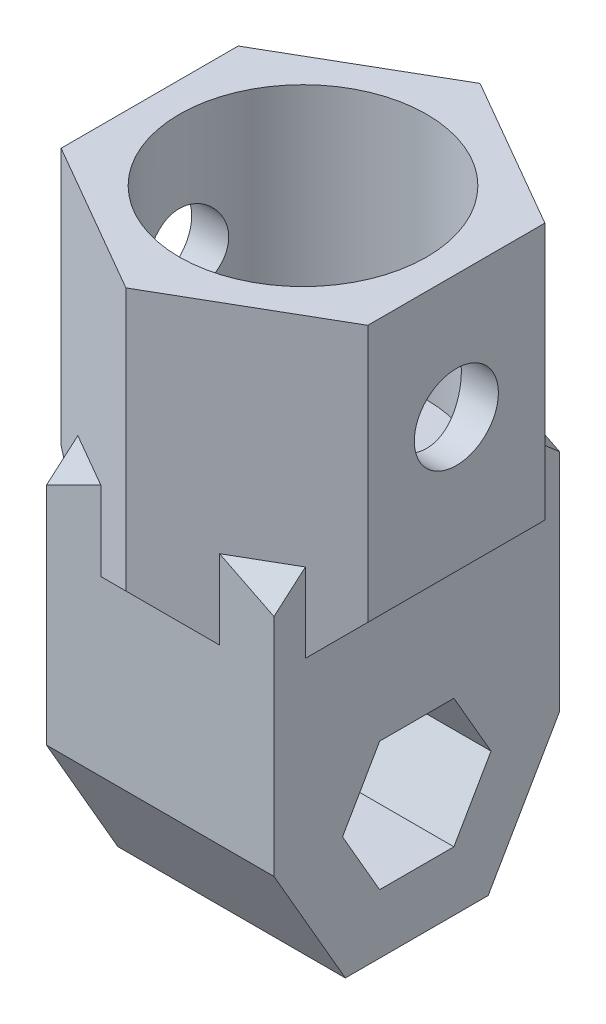
from build123d import *

# Parameters (mm, degrees)
SALIENTE_EXTRUIR1_DEPTH      = 4.6
SALIENTE_EXTRUIR1_DEPTH_BACK = 4.6
SALIENTE_EXTRUIR2_START      = 4
CROQUIS2_R                   = 5
SALIENTE_EXTRUIR2_DEPTH      = 10
CROQUIS4_W                   = 9.2
CROQUIS4_H                   = 2.771281292
SALIENTE_EXTRUIR3_DEPTH      = 9
SALIENTE_EXTRUIR4_START      = 2.6
CROQUIS4_3_W                 = 9.2
CROQUIS4_3_H                 = 6.0044428
SALIENTE_EXTRUIR4_DEPTH      = 6.4
SALIENTE_EXTRUIR5_START      = 3.6
CROQUIS2_2_R                 = 5
SALIENTE_EXTRUIR5_DEPTH      = 0.4
CHAFL_N1_SIZE                = 1.2
CHAFL_N2_SIZE                = 1.6
CROQUIS5_R                   = 1.7
CORTAR_EXTRUIR1_DEPTH        = 24.791034726


with BuildPart() as part:
    # Croquis1 → Saliente-Extruir1 (new, two sides: drawn at the far end of the back side and taken through both)
    with BuildSketch(Plane(origin=(0, 0, 0), x_dir=(0, 0, -1), z_dir=(1, 0, 0)).offset(-SALIENTE_EXTRUIR1_DEPTH_BACK)):
        Polygon((2.886751346, 5), (-2.886751346, 5), (-5.773502692, 0), (-2.886751346, -5), (2.886751346, -5), (5.773502692, 0), align=None)
        Polygon((3.0022214, 0), (1.5011107, 2.6), (-1.5011107, 2.6), (-3.0022214, 0), (-1.5011107, -2.6), (1.5011107, -2.6), align=None, mode=Mode.SUBTRACT)
    extrude(amount=SALIENTE_EXTRUIR1_DEPTH + SALIENTE_EXTRUIR1_DEPTH_BACK)



with BuildPart() as body_2:
    # Croquis2 → Saliente-Extruir2 (new body)
    with BuildSketch(Plane(origin=(0, 5, 0), x_dir=(1, 0, 0), z_dir=(0, 1, 0)).offset(SALIENTE_EXTRUIR2_START)):
        Polygon((0, 7.159143338), (-6.2, 3.579571669), (-6.2, -3.579571669), (0, -7.159143338), (6.2, -3.579571669), (6.2, 3.579571669), align=None)
        with Locations(Location((0, 0, 0), (0, 0, 270))):
            Circle(CROQUIS2_R, mode=Mode.SUBTRACT)
    extrude(amount=SALIENTE_EXTRUIR2_DEPTH)


with BuildPart() as part_1:
    add(part.part)

    add(body_2.part)  # Saliente-Extruir3 merges body 2
    # Croquis4 → Saliente-Extruir3 (add)
    with BuildSketch(Plane(origin=(0, 0, 0), x_dir=(1, 0, 0), z_dir=(0, 1, 0))):
        with Locations((0, -4.387862046)):
            Rectangle(CROQUIS4_W, CROQUIS4_H)
        with Locations((0, 4.387862046)):
            Rectangle(CROQUIS4_W, CROQUIS4_H)
    extrude(amount=SALIENTE_EXTRUIR3_DEPTH)

    # Croquis4<3> → Saliente-Extruir4 (add)
    with BuildSketch(Plane(origin=(0, 0, 0), x_dir=(1, 0, 0), z_dir=(0, 1, 0)).offset(SALIENTE_EXTRUIR4_START)):
        Rectangle(CROQUIS4_3_W, CROQUIS4_3_H)
    extrude(amount=SALIENTE_EXTRUIR4_DEPTH)

    # Croquis2<2> → Saliente-Extruir5 (add)
    # profile 1 of 2: a face of its own
    with BuildSketch(Plane(origin=(0, 5, 0), x_dir=(1, 0, 0), z_dir=(0, 1, 0)).offset(SALIENTE_EXTRUIR5_START)):
        Polygon((6.2, -3.579571669), (6.2, 3.579571669), (0, 7.159143338), (-6.2, 3.579571669), (-6.2, -3.579571669), (0, -7.159143338), align=None)
        with Locations(Location((0, 0, 0), (0, 0, 270))):
            Circle(CROQUIS2_2_R, mode=Mode.SUBTRACT)
    # profile 2 of 2: a face of its own
    with BuildSketch(Plane(origin=(0, 5, 0), x_dir=(1, 0, 0), z_dir=(0, 1, 0)).offset(SALIENTE_EXTRUIR5_START)):
        with Locations(Location((0, 0, 0), (0, 0, 270))):
            Circle(CROQUIS2_2_R)
    extrude(amount=SALIENTE_EXTRUIR5_DEPTH)

    # Chaflán1
    # the kernel refuses this chamfer: 1.2 mm, written as the material it adds along each edge
    with BuildSketch(Plane(origin=(-0.272571358, 9, 7.316512485), x_dir=(0.49981095845564805, -0.027495876610585935, 0.8656979742248805), z_dir=(0.8660254037844388, 0, -0.49999999999999967))) as chafl_n1_piece_1_section:
        Polygon((CHAFL_N1_SIZE * 0.999621916911, -CHAFL_N1_SIZE * 0.0274958766106), (-CHAFL_N1_SIZE * 0.0274958766106, -CHAFL_N1_SIZE * 0.999621916911), (0, 0), align=None)
    chafl_n1_piece_1 = extrude(amount=8.712380356, mode=Mode.PRIVATE)
    chafl_n1_piece_1 = split(chafl_n1_piece_1, bisect_by=Plane(origin=(4.6, 9.457, 5.303539573), z_dir=(-1, 0, 0)), keep=Keep.TOP, mode=Mode.PRIVATE)
    chafl_n1_piece_1 = split(chafl_n1_piece_1, bisect_by=Plane(origin=(3.786, 9.457, 5.773502692), z_dir=(0, 0, -1)), keep=Keep.TOP, mode=Mode.PRIVATE)
    add(chafl_n1_piece_1)
    with BuildSketch(Plane(origin=(-7.272571358, 9, 2.960322307), x_dir=(-0.4998109584556484, -0.027495876610585918, 0.8656979742248802), z_dir=(0.8660254037844387, 0, 0.5000000000000001))) as chafl_n1_piece_2_section:
        Polygon((CHAFL_N1_SIZE * 0.999621916911, -CHAFL_N1_SIZE * 0.0274958766106), (-CHAFL_N1_SIZE * 0.0274958766106, -CHAFL_N1_SIZE * 0.999621916911), (0, 0), align=None)
    chafl_n1_piece_2 = extrude(amount=8.712380356, mode=Mode.PRIVATE)
    chafl_n1_piece_2 = split(chafl_n1_piece_2, bisect_by=Plane(origin=(-4.6, 9.457, 5.303539573), z_dir=(1, 0, 0)), keep=Keep.TOP, mode=Mode.PRIVATE)
    chafl_n1_piece_2 = split(chafl_n1_piece_2, bisect_by=Plane(origin=(-3.786, 9.457, 5.773502692), z_dir=(0, 0, -1)), keep=Keep.TOP, mode=Mode.PRIVATE)
    add(chafl_n1_piece_2)
    with BuildSketch(Plane(origin=(0.272571358, 9, -7.316512485), x_dir=(-0.49981095845564827, -0.027495876610585914, -0.8656979742248804), z_dir=(-0.8660254037844387, 0, 0.49999999999999994))) as chafl_n1_piece_3_section:
        Polygon((CHAFL_N1_SIZE * 0.999621916911, -CHAFL_N1_SIZE * 0.0274958766106), (-CHAFL_N1_SIZE * 0.0274958766106, -CHAFL_N1_SIZE * 0.999621916911), (0, 0), align=None)
    chafl_n1_piece_3 = extrude(amount=8.712380356, mode=Mode.PRIVATE)
    chafl_n1_piece_3 = split(chafl_n1_piece_3, bisect_by=Plane(origin=(-4.6, 9.457, -5.303539573), z_dir=(1, 0, 0)), keep=Keep.TOP, mode=Mode.PRIVATE)
    chafl_n1_piece_3 = split(chafl_n1_piece_3, bisect_by=Plane(origin=(-3.786, 9.457, -5.773502692), z_dir=(0, 0, 1)), keep=Keep.TOP, mode=Mode.PRIVATE)
    add(chafl_n1_piece_3)
    with BuildSketch(Plane(origin=(7.272571358, 9, -2.960322307), x_dir=(-0.013747938305293247, 0.9996219169112968, 0.023812127644090377), z_dir=(-0.8660254037844387, 0, -0.5000000000000001))) as chafl_n1_piece_4_section:
        Polygon((CHAFL_N1_SIZE * 0.999621916911, CHAFL_N1_SIZE * 0.0274958766106), (-CHAFL_N1_SIZE * 0.0274958766106, CHAFL_N1_SIZE * 0.999621916911), (0, 0), align=None)
    chafl_n1_piece_4 = extrude(amount=8.712380356, mode=Mode.PRIVATE)
    chafl_n1_piece_4 = split(chafl_n1_piece_4, bisect_by=Plane(origin=(4.6, 9.457, -5.303539573), z_dir=(-1, 0, 0)), keep=Keep.TOP, mode=Mode.PRIVATE)
    chafl_n1_piece_4 = split(chafl_n1_piece_4, bisect_by=Plane(origin=(3.786, 9.457, -5.773502692), z_dir=(0, 0, 1)), keep=Keep.TOP, mode=Mode.PRIVATE)
    add(chafl_n1_piece_4)

    # Chaflán2
    # the kernel refuses this chamfer: 1.6 mm, written as the material it adds along each edge
    with BuildSketch(Plane(origin=(4.6, 8.6, -8.61802488), x_dir=(0.9996219169112968, 0.027495876610586285, 0), z_dir=(0, 0, 1))) as chafl_n2_piece_1_section:
        Polygon((CHAFL_N2_SIZE * 0.999621916911, -CHAFL_N2_SIZE * 0.0274958766106), (-CHAFL_N2_SIZE * 0.0274958766106, -CHAFL_N2_SIZE * 0.999621916911), (0, 0), align=None)
    chafl_n2_piece_1 = extrude(amount=17.236049761, mode=Mode.PRIVATE)
    chafl_n2_piece_1 = split(chafl_n2_piece_1, bisect_by=Plane(origin=(6.927780638, 8.059532411, -3.159387322), z_dir=(-0.5000000000000001, 0, 0.8660254037844387)), keep=Keep.TOP, mode=Mode.PRIVATE)
    chafl_n2_piece_1 = split(chafl_n2_piece_1, bisect_by=Plane(origin=(6.927780638, 8.059532411, 3.159387322), z_dir=(-0.49999999999999967, 0, -0.8660254037844388)), keep=Keep.TOP, mode=Mode.PRIVATE)
    chafl_n2_piece_1 = split(chafl_n2_piece_1, bisect_by=Plane(origin=(6.2, 8.059532411, 0), z_dir=(-1, 0, 0)), keep=Keep.TOP, mode=Mode.PRIVATE)
    add(chafl_n2_piece_1)
    with BuildSketch(Plane(origin=(-6.514692781, 8.6, -5.773502692), x_dir=(0, 0.027495876610586265, -0.9996219169112966), z_dir=(1, 0, 0))) as chafl_n2_piece_2_section:
        Polygon((CHAFL_N2_SIZE * 0.999621916911, -CHAFL_N2_SIZE * 0.0274958766106), (-CHAFL_N2_SIZE * 0.0274958766106, -CHAFL_N2_SIZE * 0.999621916911), (0, 0), align=None)
    chafl_n2_piece_2 = extrude(amount=13.029385561, mode=Mode.PRIVATE)
    chafl_n2_piece_2 = split(chafl_n2_piece_2, bisect_by=Plane(origin=(0.451958261, 7.972982249, -6.898205114), z_dir=(-0.5000000000000001, 0, 0.8660254037844387)), keep=Keep.TOP, mode=Mode.PRIVATE)
    chafl_n2_piece_2 = split(chafl_n2_piece_2, bisect_by=Plane(origin=(-0.451958261, 7.972982249, -6.898205114), z_dir=(0.49999999999999994, 0, 0.8660254037844387)), keep=Keep.TOP, mode=Mode.PRIVATE)
    add(chafl_n2_piece_2)
    with BuildSketch(Plane(origin=(-4.6, 8.6, -8.61802488), x_dir=(0.027495876610586285, -0.9996219169112968, 0), z_dir=(0, 0, 1))) as chafl_n2_piece_3_section:
        Polygon((CHAFL_N2_SIZE * 0.999621916911, -CHAFL_N2_SIZE * 0.0274958766106), (-CHAFL_N2_SIZE * 0.0274958766106, -CHAFL_N2_SIZE * 0.999621916911), (0, 0), align=None)
    chafl_n2_piece_3 = extrude(amount=17.236049761, mode=Mode.PRIVATE)
    chafl_n2_piece_3 = split(chafl_n2_piece_3, bisect_by=Plane(origin=(-6.927780638, 8.059532411, -3.159387322), z_dir=(0.49999999999999994, 0, 0.8660254037844387)), keep=Keep.TOP, mode=Mode.PRIVATE)
    chafl_n2_piece_3 = split(chafl_n2_piece_3, bisect_by=Plane(origin=(-6.927780638, 8.059532411, 3.159387322), z_dir=(0.5000000000000001, 0, -0.8660254037844387)), keep=Keep.TOP, mode=Mode.PRIVATE)
    chafl_n2_piece_3 = split(chafl_n2_piece_3, bisect_by=Plane(origin=(-6.2, 8.059532411, 0), z_dir=(1, 0, 0)), keep=Keep.TOP, mode=Mode.PRIVATE)
    add(chafl_n2_piece_3)
    with BuildSketch(Plane(origin=(-6.514692781, 8.6, 5.773502692), x_dir=(0, 0.027495876610586265, 0.9996219169112966), z_dir=(1, 0, 0))) as chafl_n2_piece_4_section:
        Polygon((CHAFL_N2_SIZE * 0.999621916911, CHAFL_N2_SIZE * 0.0274958766106), (-CHAFL_N2_SIZE * 0.0274958766106, CHAFL_N2_SIZE * 0.999621916911), (0, 0), align=None)
    chafl_n2_piece_4 = extrude(amount=13.029385561, mode=Mode.PRIVATE)
    chafl_n2_piece_4 = split(chafl_n2_piece_4, bisect_by=Plane(origin=(0.451958261, 7.972982249, 6.898205114), z_dir=(-0.49999999999999967, 0, -0.8660254037844388)), keep=Keep.TOP, mode=Mode.PRIVATE)
    chafl_n2_piece_4 = split(chafl_n2_piece_4, bisect_by=Plane(origin=(-0.451958261, 7.972982249, 6.898205114), z_dir=(0.5000000000000001, 0, -0.8660254037844387)), keep=Keep.TOP, mode=Mode.PRIVATE)
    add(chafl_n2_piece_4)

    # Croquis5 → Cortar-Extruir1 (cut, through all)
    with BuildSketch(Plane(origin=(6.2, 0, 0), x_dir=(0, 0, -1), z_dir=(1, 0, 0))):
        with Locations((0, 14)):
            Circle(CROQUIS5_R)
    extrude(amount=-CORTAR_EXTRUIR1_DEPTH, mode=Mode.SUBTRACT)


solid = part_1.part
